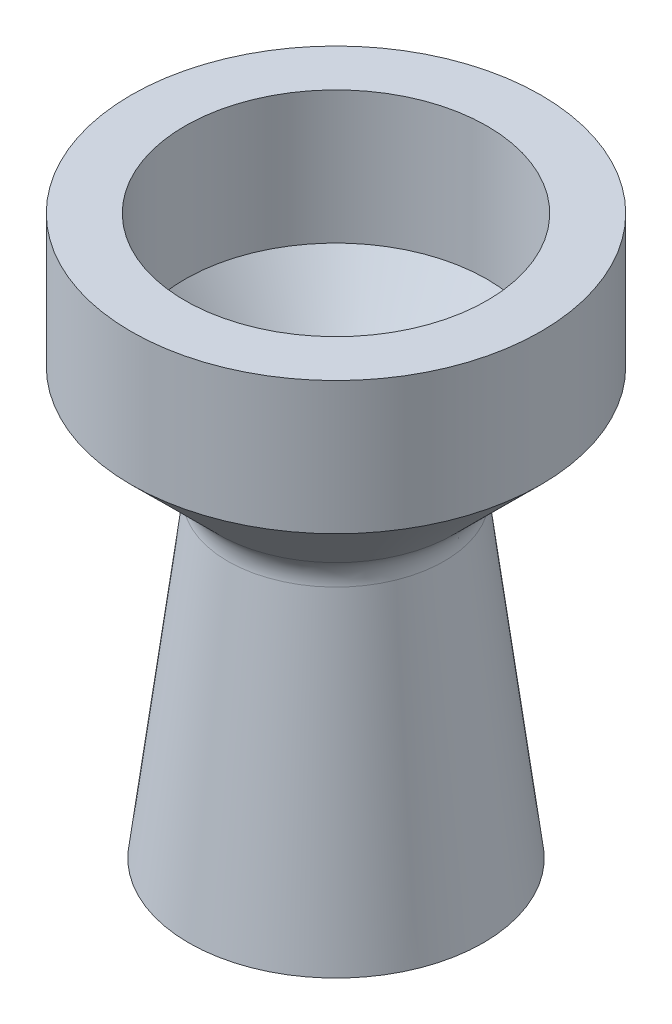
from build123d import *


with BuildPart() as part:
    # Sketch1 → Revolve1 (revolve)
    with BuildSketch(Plane.XY):
        with BuildLine():
            Line((-30.5, -4.75), (-30.5, -24.5))
            Line((-30.5, -24.5), (-17.546479114, -37.38872493))
            ThreePointArc((-17.546479114, -37.38872493), (-16.345380158, -39.305748231), (-16.112075173, -41.55590063))
            Line((-16.112075173, -41.55590063), (-21.9242797, -87.855289157))
            Line((-21.9242797, -87.855289157), (-18.4242797, -87.855289157))
            Line((-18.4242797, -87.855289157), (-12, -39.120191517))
            Line((-12, -39.120191517), (-22.5, -24.5))
            Line((-22.5, -24.5), (-22.5, -4.75))
            Line((-22.5, -4.75), (-30.5, -4.75))
        make_face()
    revolve(axis=Axis((0, 0, 0), (0, 1, 0)))


solid = part.part
